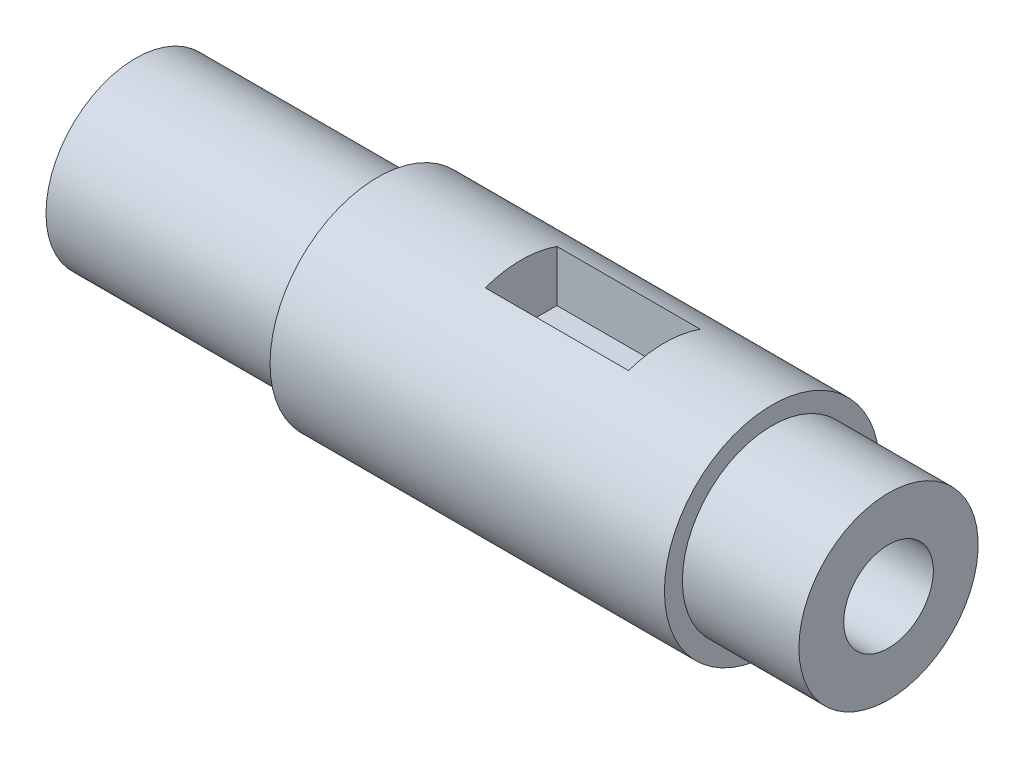
from build123d import *

# Parameters (mm, degrees)
SKETCH2_W          = 8
SKETCH2_H          = 4
CUT_EXTRUDE1_DEPTH = 3.2


with BuildPart() as part:
    # Sketch1 → Revolve1 (revolve)
    with BuildSketch(Plane.XY):
        Polygon((-21, 2.5), (21, 2.5), (21, 5), (14.5, 5), (14.5, 6), (-7.5, 6), (-7.5, 5), (-21, 5), align=None)
    revolve(axis=Axis((-21, 0, 0), (1, 0, 0)))

    # Sketch2 → Cut-Extrude1 (cut)
    with BuildSketch(Plane(origin=(0, 6, 0), x_dir=(1, 0, 0), z_dir=(0, 1, 0))):
        with Locations((4.5, 0)):
            Rectangle(SKETCH2_W, SKETCH2_H)
    extrude(amount=-CUT_EXTRUDE1_DEPTH, mode=Mode.SUBTRACT)


solid = part.part
